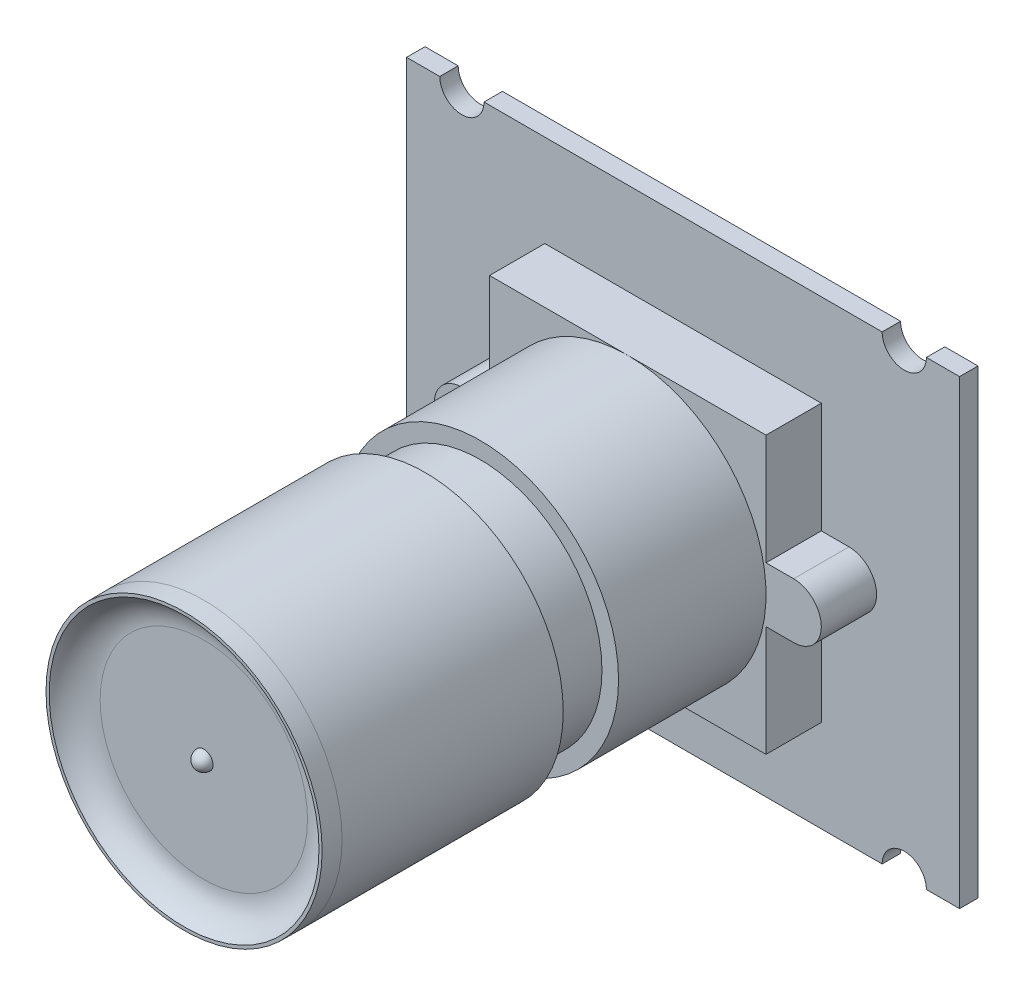
from build123d import *

# Parameters (mm, degrees)
EXTRUDE_1_DEPTH = 1
EXTRUDE_2_DEPTH = 3
SKETCH_3_W      = 15
SKETCH_3_H      = 15
EXTRUDE_3_DEPTH = 3
SKETCH_4_R      = 7.5
EXTRUDE_4_DEPTH = 8
SKETCH_5_R      = 6.6
EXTRUDE_5_DEPTH = 3


with BuildPart() as part:
    # 草图1 → 凸台-拉伸1 (new body)
    with BuildSketch(Plane.XY):
        with BuildLine():
            Line((4.2, 8.956043956), (25.8, 8.956043956))
            ThreePointArc((25.8, 8.956043956), (27, 7.756043956), (28.2, 8.956043956))
            Line((28.2, 8.956043956), (30, 8.956043956))
            Line((30, 8.956043956), (30, -16.043956044))
            Line((30, -16.043956044), (28.2, -16.043956044))
            ThreePointArc((28.2, -16.043956044), (27, -14.843956044), (25.8, -16.043956044))
            Line((25.8, -16.043956044), (4.2, -16.043956044))
            ThreePointArc((4.2, -16.043956044), (3, -14.843956044), (1.8, -16.043956044))
            Line((1.8, -16.043956044), (0, -16.043956044))
            Line((0, -16.043956044), (0, 8.956043956))
            Line((0, 8.956043956), (1.8, 8.956043956))
            ThreePointArc((1.8, 8.956043956), (3, 7.756043956), (4.2, 8.956043956))
        make_face()
    extrude(amount=EXTRUDE_1_DEPTH)

    # 草图2 → 凸台-拉伸2 (add)
    with BuildSketch(Plane.XY.offset(1)):
        with BuildLine():
            Line((6, -2.043956044), (24, -2.043956044))
            ThreePointArc((24, -2.043956044), (25.5, -3.543956044), (24, -5.043956044))
            Line((24, -5.043956044), (6, -5.043956044))
            ThreePointArc((6, -5.043956044), (4.5, -3.543956044), (6, -2.043956044))
        make_face()
    extrude(amount=EXTRUDE_2_DEPTH)

    # 草图3 → 凸台-拉伸3 (add)
    with BuildSketch(Plane.XY.offset(1)):
        with Locations((15, -3.543956044)):
            Rectangle(SKETCH_3_W, SKETCH_3_H)
    extrude(amount=EXTRUDE_3_DEPTH)

    # 草图4 → 凸台-拉伸4 (add)
    with BuildSketch(Plane.XY.offset(4)):
        with Locations((15, -3.543956044)):
            Circle(SKETCH_4_R)
    extrude(amount=EXTRUDE_4_DEPTH)

    # 草图5 → 凸台-拉伸5 (add)
    with BuildSketch(Plane.XY.offset(12)):
        with Locations((15, -3.543956044)):
            Circle(SKETCH_5_R)
    extrude(amount=EXTRUDE_5_DEPTH)

    # 草图7 → 旋转2 (revolve)
    with BuildSketch(Plane(origin=(0, -3.543956044, 0), x_dir=(-1, 0, 0), z_dir=(0, -1, 0))):
        with BuildLine():
            Line((-15, -15), (-7.5, -15))
            Line((-7.5, -15), (-7.5, -27))
            Line((-7.5, -27), (-7.5095257, -28.070803971))
            Line((-7.5095257, -28.070803971), (-7.681219097, -28.070803971))
            ThreePointArc((-7.681219097, -28.070803971), (-8.373062515, -27.290151024), (-9.375, -27))
            Line((-9.375, -27), (-14.500000001, -27))
            ThreePointArc((-14.500000001, -27), (-14.646437925, -27.353569269), (-15, -27.500024563))
            Line((-15, -27.500024563), (-15, -27.000024563))
            Line((-15, -27.000024563), (-15, -22))
            Line((-15, -22), (-15, -15))
        make_face()
    revolve(axis=Axis((15, -3.543956044, 22), (0, 0, -1)))


solid = part.part
